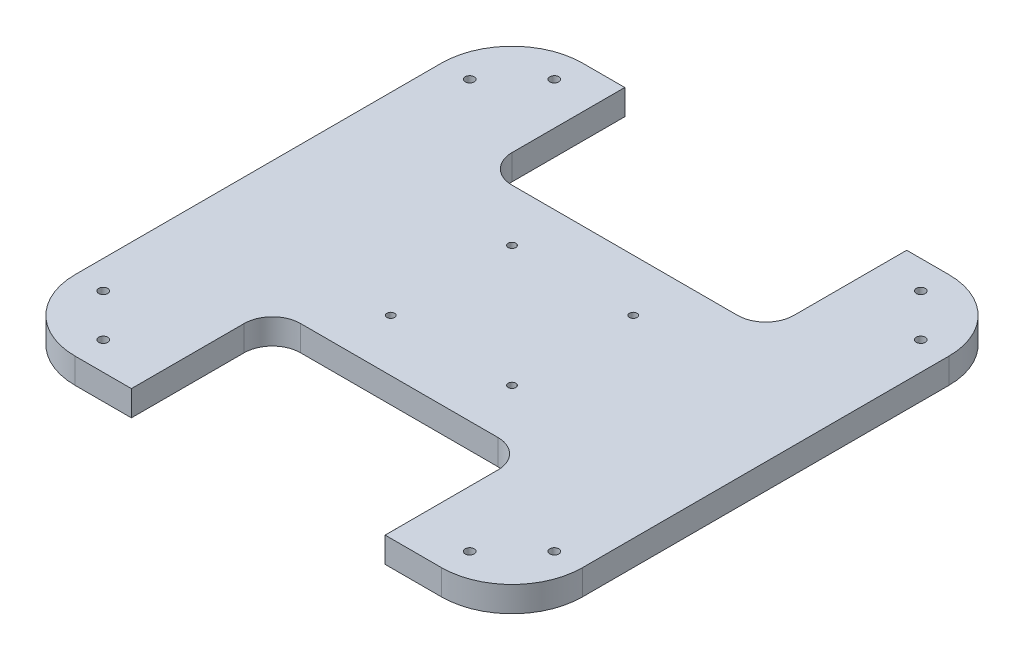
from build123d import *

# Parameters (mm, degrees)
PLATE_DEPTH        = 9
SKETCH3_R          = 1.6
HEX_HOLES_DEPTH    = 128.597021909
SKETCH4_R          = 1.35
LIDAR_HOLES_DEPTH  = 128.597021909
SKETCH5_W          = 100
SKETCH5_H          = 50
SKETCH5_W_2        = 90
CUT_EXTRUDE1_DEPTH = 128.597021909
SKETCH6_R          = 3.5
CUT_EXTRUDE2_DEPTH = 5
FILLET1_R          = 10


with BuildPart() as part:
    # Sketch1 → Plate (new body)
    with BuildSketch(Plane(origin=(0, 0, 0), x_dir=(1, 0, 0), z_dir=(0, 1, 0))):
        with BuildLine():
            Line((-65, -90), (65, -90))
            ThreePointArc((65, -90), (82.67766953, -82.67766953), (90, -65))
            Line((90, -65), (90, 65))
            ThreePointArc((90, 65), (82.67766953, 82.67766953), (65, 90))
            Line((65, 90), (-65, 90))
            ThreePointArc((-65, 90), (-82.67766953, 82.67766953), (-90, 65))
            Line((-90, 65), (-90, -65))
            ThreePointArc((-90, -65), (-82.67766953, -82.67766953), (-65, -90))
        make_face()
    extrude(amount=PLATE_DEPTH)

    # Sketch3 → Hex Holes (cut, through all)
    with BuildSketch(Plane(origin=(0, 9, 0), x_dir=(1, 0, 0), z_dir=(0, 1, 0))):
        with Locations((-65, 80)):
            Circle(SKETCH3_R)
        with Locations((-80, 65)):
            Circle(SKETCH3_R)
        with Locations((80, 65)):
            Circle(SKETCH3_R)
        with Locations((80, -65)):
            Circle(SKETCH3_R)
        with Locations((65, 80)):
            Circle(SKETCH3_R)
        with Locations((65, -80)):
            Circle(SKETCH3_R)
        with Locations((-65, -80)):
            Circle(SKETCH3_R)
        with Locations((-80, -65)):
            Circle(SKETCH3_R)
    extrude(amount=-HEX_HOLES_DEPTH, mode=Mode.SUBTRACT)

    # Sketch4 → LiDAR Holes (cut, through all)
    with BuildSketch(Plane(origin=(0, 9, 0), x_dir=(1, 0, 0), z_dir=(0, 1, 0))):
        with Locations((-21.5, 21.5)):
            Circle(SKETCH4_R)
        with Locations((21.5, 21.5)):
            Circle(SKETCH4_R)
        with Locations((21.5, -21.5)):
            Circle(SKETCH4_R)
        with Locations((-21.5, -21.5)):
            Circle(SKETCH4_R)
    extrude(amount=-LIDAR_HOLES_DEPTH, mode=Mode.SUBTRACT)

    # Sketch5 → Cut-Extrude1 (cut, through all)
    with BuildSketch(Plane(origin=(0, 9, 0), x_dir=(1, 0, 0), z_dir=(0, 1, 0))):
        with Locations((0, 65)):
            Rectangle(SKETCH5_W, SKETCH5_H)
        with Locations((0, -65)):
            Rectangle(SKETCH5_W_2, SKETCH5_H)
    extrude(amount=-CUT_EXTRUDE1_DEPTH, mode=Mode.SUBTRACT)

    # Sketch6 → Cut-Extrude2 (cut)
    with BuildSketch(Plane.XZ):
        with Locations((-21.5, 21.5)):
            Circle(SKETCH6_R)
        with Locations((21.5, 21.5)):
            Circle(SKETCH6_R)
        with Locations((-21.5, -21.5)):
            Circle(SKETCH6_R)
        with Locations((21.5, -21.5)):
            Circle(SKETCH6_R)
    extrude(amount=-CUT_EXTRUDE2_DEPTH, mode=Mode.SUBTRACT)

    # Fillet1
    fillet1_edges = [part.edges().sort_by_distance(p)[0] for p in [
        (45, 4.5, 40),
        (-45, 4.5, 40),
        (50, 4.5, -40),
        (-50, 4.5, -40),
    ]]
    fillet(fillet1_edges, radius=FILLET1_R)


solid = part.part
